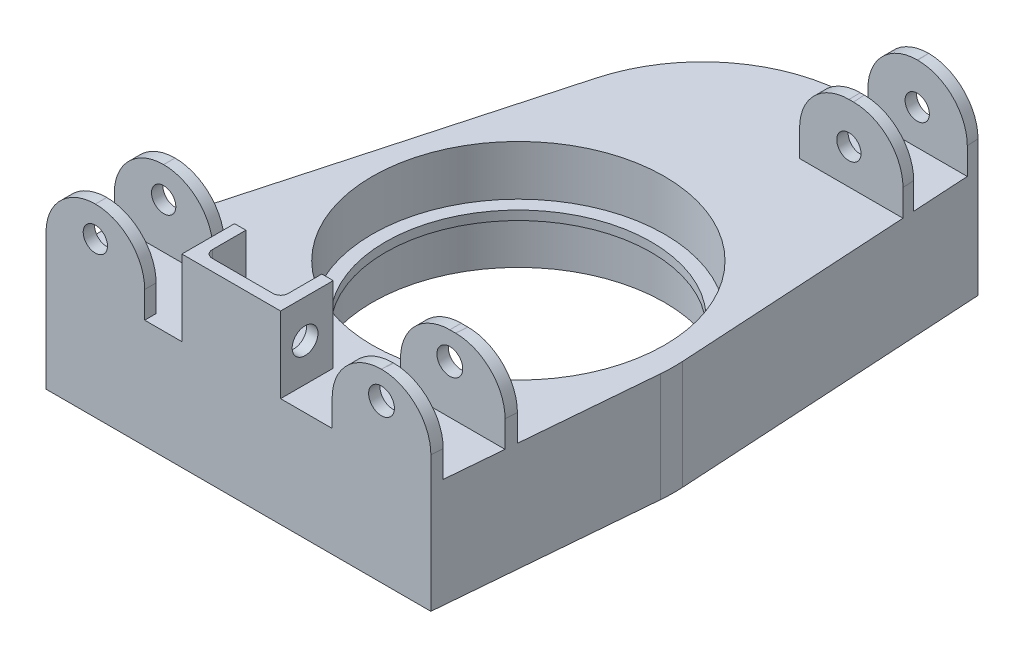
from build123d import *

# Parameters (mm, degrees)
SKETCH1_R                      = 48.895
BASE_DEPTH                     = 36.5
SKETCH2_W                      = 33.019999999999996
SKETCH2_H                      = 3.8100000000000023
A_ARMS_DEPTH                   = 25.4
FILLET_A_ARM_TAB_F_R           = 16.51
FILLET2_R                      = 50.8
SKETCH3_R                      = 4.191000000000014
SKETCH3_R_2                    = 4.190999999999996
BOSS_EXTRUDE3_DEPTH            = 10
FILLET3_R                      = 12.7
SKETCH6_R                      = 4.063999999999998
TAB_HOLES_1_DEPTH              = 38.1
SKETCH7_R                      = 4.064000000000002
TAB_HOLES_2_DEPTH              = 186.5408819792208
MID_FEATURE_BEARING_DEPTH      = 1.524
MID_FEATURE_BEARING_DEPTH_BACK = 1.524
SKETCH8_R                      = 48.895
SKETCH8_R_2                    = 44.449999999999996
SKETCH9_W                      = 3.8100000000000023
SKETCH9_H                      = 13.79577582478543
BOSS_EXTRUDE5_DEPTH            = 25.4
PUSHROD_STR_R                  = 2.54
SKETCH10_R                     = 4.318000000000003
PUSHROD_HOLES_DEPTH            = 151.10266140654986
SKETCH11_R                     = 4.317999999999998
TAB_HOLES_3_DEPTH              = 50.8


with BuildPart() as part:
    # Sketch1 → Base (new body)
    with BuildSketch(Plane(origin=(0, 0, 0), x_dir=(1, 0, 0), z_dir=(0, 1, 0))):
        with BuildLine():
            Line((-78.31659997030465, -79.72841359803415), (50.449322454190956, -79.72841359803415))
            Line((50.449322454190956, -79.72841359803415), (56.83927020061317, -5.288618846495341))
            Line((56.83927020061317, -5.288618846495341), (50.449322454190956, 103.33953733073578))
            Line((50.449322454190956, 103.33953733073578), (9.063812231160846, 103.33953733073578))
            ThreePointArc((9.063812231160846, 103.33953733073578), (-21.715617266777734, 92.95323203663254), (-39.90904079842039, 66.04137669220931))
            Line((-39.90904079842039, 66.04137669220931), (-72.74491081630002, -53.05841359803415))
            Line((-72.74491081630002, -53.05841359803415), (-78.31659997030464, -53.05841359803415))
            Line((-78.31659997030464, -53.05841359803415), (-78.31659997030465, -79.72841359803415))
        make_face()
        with Locations(Location((0, 0, 0), (0, 0, 270))):
            Circle(SKETCH1_R, mode=Mode.SUBTRACT)
    extrude(amount=BASE_DEPTH)

    # Sketch2 → A-Arms (add)
    with BuildSketch(Plane(origin=(0, 36.5, 0), x_dir=(1, 0, 0), z_dir=(0, 1, 0))):
        Polygon((50.449322454190956, 103.3395373307358), (50.673442072627154, 99.52953733073582), (17.429322454190952, 99.52953733073582), (17.429322454190952, 103.33953733073581), align=None)
        Polygon((17.429322454190977, -75.91841359803415), (50.77637468472341, -75.91841359803415), (50.449322454190956, -79.72841359803415), (17.429322454190974, -79.72841359803415), align=None)
        Polygon((17.429322454190952, 80.47953733073582), (17.42932245419096, 76.66953733073582), (52.01815978324433, 76.66953733073582), (51.79404016480813, 80.47953733073582), align=None)
        Polygon((17.429322454190974, -53.05841359803416), (52.738688067918105, -53.058413598034164), (52.41163583738566, -56.86841359803416), (17.429322454190974, -56.86841359803416), align=None)
        Polygon((-45.296599970304655, -53.05841359803415), (-78.31659997030464, -53.05841359803415), (-78.31659997030465, -56.86841359803416), (-45.296599970304655, -56.86841359803415), align=None)
        with Locations((-61.80659997030465, -77.82341359803415)):
            Rectangle(SKETCH2_W, SKETCH2_H)
    extrude(amount=A_ARMS_DEPTH)

    # Fillet a-arm tab f
    # the kernel refuses this fillet: 16.51 mm, written as the material it takes off along each edge
    with BuildSketch(Plane(origin=(54.3064585195025, 61.9, 34.794647560383474), x_dir=(0, -1, 0), z_dir=(-0.08552595602129841, 0, 0.9963359427656131))) as fillet_a_arm_tab_f_piece_1:
        with BuildLine():
            CenterArc((FILLET_A_ARM_TAB_F_R, -FILLET_A_ARM_TAB_F_R), FILLET_A_ARM_TAB_F_R, 90, 90)
            Line((-7.11e-15, -FILLET_A_ARM_TAB_F_R), (0, 0))
            Line((0, 0), (FILLET_A_ARM_TAB_F_R, 0))
        make_face()
    extrude(amount=86.37401139662217, mode=Mode.SUBTRACT)
    with BuildSketch(Plane(origin=(56.2687719026972, 61.9, 11.93464756038351), x_dir=(-4.3e-16, -1, -4e-17), z_dir=(-0.08552595602129671, 0, 0.9963359427656132))) as fillet_a_arm_tab_f_piece_2:
        with BuildLine():
            CenterArc((FILLET_A_ARM_TAB_F_R, -FILLET_A_ARM_TAB_F_R), FILLET_A_ARM_TAB_F_R, 90.00000000000003, 89.99999999999997)
            Line((-3e-17, -FILLET_A_ARM_TAB_F_R), (0, 0))
            Line((0, 0), (FILLET_A_ARM_TAB_F_R, 0))
        make_face()
    extrude(amount=86.37401139662215, mode=Mode.SUBTRACT)
    with BuildSketch(Plane(origin=(17.429322454190935, 61.9, 121.00341359803414), x_dir=(1, 4.3e-16, 9.3e-16), z_dir=(9.3e-16, 0, -1))) as fillet_a_arm_tab_f_piece_3:
        with BuildLine():
            CenterArc((FILLET_A_ARM_TAB_F_R, FILLET_A_ARM_TAB_F_R), FILLET_A_ARM_TAB_F_R, 180.00000000000003, 90)
            Line((-1.421e-14, FILLET_A_ARM_TAB_F_R), (0, 0))
            Line((0, 0), (FILLET_A_ARM_TAB_F_R, 0))
        make_face()
    extrude(amount=86.35999999999999, mode=Mode.SUBTRACT)
    with BuildSketch(Plane(origin=(17.429322454190974, 61.9, 98.14341359803416), x_dir=(-2.2e-16, -1, 0), z_dir=(0, 0, -1))) as fillet_a_arm_tab_f_piece_4:
        with BuildLine():
            CenterArc((FILLET_A_ARM_TAB_F_R, -FILLET_A_ARM_TAB_F_R), FILLET_A_ARM_TAB_F_R, 89.99999999999999, 90.00000000000001)
            Line((-1.066e-14, -FILLET_A_ARM_TAB_F_R), (0, 0))
            Line((0, 0), (FILLET_A_ARM_TAB_F_R, 0))
        make_face()
    extrude(amount=86.35999999999999, mode=Mode.SUBTRACT)
    with BuildSketch(Plane(origin=(54.44193248550869, 61.9, -35.46576382772086), x_dir=(3e-17, -1, 0), z_dir=(-0.05872253669931843, 0, -0.9982743428955776))) as fillet_a_arm_tab_f_piece_5:
        with BuildLine():
            CenterArc((FILLET_A_ARM_TAB_F_R, FILLET_A_ARM_TAB_F_R), FILLET_A_ARM_TAB_F_R, 180, 90)
            Line((-7.52e-15, FILLET_A_ARM_TAB_F_R), (0, 0))
            Line((0, 0), (FILLET_A_ARM_TAB_F_R, 0))
        make_face()
    extrude(amount=86.36658611895079, mode=Mode.SUBTRACT)
    with BuildSketch(Plane(origin=(48.025549751926604, 61.9, -144.54331083375075), x_dir=(-0.9982743428955775, 0, 0.05872253669931885), z_dir=(0.058722536699318865, 0, 0.9982743428955776))) as fillet_a_arm_tab_f_piece_6:
        with BuildLine():
            CenterArc((FILLET_A_ARM_TAB_F_R, FILLET_A_ARM_TAB_F_R), FILLET_A_ARM_TAB_F_R, 180.00000000000003, 90)
            Line((-8.77e-15, FILLET_A_ARM_TAB_F_R), (0, 0))
            Line((0, 0), (FILLET_A_ARM_TAB_F_R, 0))
        make_face()
    extrude(amount=86.36658611895078, mode=Mode.SUBTRACT)
    with BuildSketch(Plane(origin=(17.429322454190874, 61.9, -121.75453733073583), x_dir=(-2.2e-16, -1, 0), z_dir=(1.86e-15, 0, 1))) as fillet_a_arm_tab_f_piece_7:
        with BuildLine():
            CenterArc((FILLET_A_ARM_TAB_F_R, FILLET_A_ARM_TAB_F_R), FILLET_A_ARM_TAB_F_R, 180, 90)
            Line((-1.066e-14, FILLET_A_ARM_TAB_F_R), (0, 0))
            Line((0, 0), (FILLET_A_ARM_TAB_F_R, 0))
        make_face()
    extrude(amount=86.36000000000001, mode=Mode.SUBTRACT)
    with BuildSketch(Plane(origin=(17.429322454190952, 61.900000000000006, -58.25453733073583), x_dir=(2.2e-16, -1, 0), z_dir=(0, 0, -1))) as fillet_a_arm_tab_f_piece_8:
        with BuildLine():
            CenterArc((FILLET_A_ARM_TAB_F_R, -FILLET_A_ARM_TAB_F_R), FILLET_A_ARM_TAB_F_R, 90.00000000000001, 89.99999999999999)
            Line((3.55e-15, -FILLET_A_ARM_TAB_F_R), (0, 0))
            Line((0, 0), (FILLET_A_ARM_TAB_F_R, 0))
        make_face()
    extrude(amount=86.35999999999997, mode=Mode.SUBTRACT)
    with BuildSketch(Plane(origin=(-78.31659997030468, 61.9, 121.00341359803414), x_dir=(1, 4.3e-16, 0), z_dir=(0, 0, -1))) as fillet_a_arm_tab_f_piece_9:
        with BuildLine():
            CenterArc((FILLET_A_ARM_TAB_F_R, FILLET_A_ARM_TAB_F_R), FILLET_A_ARM_TAB_F_R, 180.00000000000003, 90)
            Line((-7.11e-15, FILLET_A_ARM_TAB_F_R), (0, 0))
            Line((0, 0), (FILLET_A_ARM_TAB_F_R, 0))
        make_face()
    extrude(amount=86.35999999999999, mode=Mode.SUBTRACT)
    with BuildSketch(Plane(origin=(-45.296599970304655, 61.900000000000006, 34.64341359803416), x_dir=(0, -1, 0), z_dir=(0, 0, 1))) as fillet_a_arm_tab_f_piece_10:
        with BuildLine():
            CenterArc((FILLET_A_ARM_TAB_F_R, -FILLET_A_ARM_TAB_F_R), FILLET_A_ARM_TAB_F_R, 90, 89.99999999999997)
            Line((0, -FILLET_A_ARM_TAB_F_R), (0, 0))
            Line((0, 0), (FILLET_A_ARM_TAB_F_R, 0))
        make_face()
    extrude(amount=86.35999999999999, mode=Mode.SUBTRACT)
    with BuildSketch(Plane(origin=(-45.296599970304655, 61.9, 98.14341359803416), x_dir=(-1, 4.3e-16, 0), z_dir=(0, 0, -1))) as fillet_a_arm_tab_f_piece_11:
        with BuildLine():
            CenterArc((FILLET_A_ARM_TAB_F_R, -FILLET_A_ARM_TAB_F_R), FILLET_A_ARM_TAB_F_R, 89.99999999999997, 90)
            Line((-7.11e-15, -FILLET_A_ARM_TAB_F_R), (0, 0))
            Line((0, 0), (FILLET_A_ARM_TAB_F_R, 0))
        make_face()
    extrude(amount=86.35999999999999, mode=Mode.SUBTRACT)
    with BuildSketch(Plane(origin=(-78.31659997030461, 61.9, 11.783413598034159), x_dir=(1, 4.3e-16, 3.73e-15), z_dir=(-3.73e-15, 0, 1))) as fillet_a_arm_tab_f_piece_12:
        with BuildLine():
            CenterArc((FILLET_A_ARM_TAB_F_R, -FILLET_A_ARM_TAB_F_R), FILLET_A_ARM_TAB_F_R, 89.99999999999997, 90)
            Line((-7.11e-15, -FILLET_A_ARM_TAB_F_R), (0, 0))
            Line((0, 0), (FILLET_A_ARM_TAB_F_R, 0))
        make_face()
    extrude(amount=86.36, mode=Mode.SUBTRACT)

    # Fillet2
    fillet2_edges = [part.edges().sort_by_distance(p)[0] for p in [
        (56.83927020061317, 18.25, 5.288618846495341),
    ]]
    fillet(fillet2_edges, radius=FILLET2_R)

    # Sketch3 → Boss-Extrude3 (add)
    with BuildSketch(Plane(origin=(0, 1, 0), x_dir=(-1, 0, 0), z_dir=(0, -1, 0))):
        with BuildLine():
            Line((43.854458680364935, 51.73085462926094), (63.97193553589411, -21.237739574507735))
            Line((63.97193553589411, -21.23773957450774), (72.18850644780878, -18.97242698412595))
            ThreePointArc((72.18850644780878, -18.972426984125953), (77.61812906849276, -10.048878041184466), (69.03903187444669, -4.089883253871238))
            ThreePointArc((69.03903187444669, -4.089883253871242), (65.51899089441646, -3.3234432694139), (63.39228079206122, -0.41565667280690477))
            Line((63.392280792061214, -0.41565667280690377), (54.01448307558028, 33.598783657509856))
            ThreePointArc((54.01448307558028, 33.598783657509856), (54.32028306249501, 37.12259649311495), (56.85200449493394, 39.59264854133208))
            ThreePointArc((56.85200449493394, 39.59264854133208), (60.937845875450805, 49.12269396499909), (51.73708276530621, 53.904097917281604))
            Line((51.73708276530621, 53.904097917281604), (43.854458680364935, 51.73085462926094))
        make_face()
        with Locations(Location((70.16323054358774, -11.626499029688759, 0), (0, 0, 90))):
            Circle(SKETCH3_R, mode=Mode.SUBTRACT)
        with Locations(Location((53.76235866952725, 46.55816996284442, 0), (0, 0, 90))):
            Circle(SKETCH3_R_2, mode=Mode.SUBTRACT)
    extrude(amount=-BOSS_EXTRUDE3_DEPTH)

    # Fillet3
    # the kernel refuses this fillet: 12.7 mm, written as the material it adds along each edge
    with BuildSketch(Plane(origin=(-43.854458680364935, 1, -51.73085462926094), x_dir=(0.26578423939908474, 0, -0.9640325399523867), z_dir=(0, 1, 0))) as fillet3_piece_1:
        with BuildLine():
            CenterArc((12.190157430730798, 12.699999999999996), FILLET3_R, 192.86192857505063, 77.13807142494932)
            Line((-0.19119096347594106, 9.872949957769716), (-1.4293258028966136, 9.59024495354669))
            ThreePointArc((-1.4293258028966136, 9.59024495354669), (-1.269999999999986, 8.176719932431535), (-1.2699999999999998, -1.12e-15))
            Line((-1.2699999999999998, -1.12e-15), (1.13e-15, -1.2699999999999996))
            Line((1.13e-15, -1.2699999999999996), (12.190157430730789, -1.2700000000000002))
            Line((12.190157430730789, -1.2700000000000002), (12.190157430730787, -3e-17))
        make_face()
    extrude(amount=10)
    with BuildSketch(Plane(origin=(-63.97193553589411, 1, 21.237739574507735), x_dir=(-0.26578423939908663, 0, 0.9640325399523861), z_dir=(0, 1, 0))) as fillet3_piece_2:
        with BuildLine():
            CenterArc((12.266078660835335, -12.700000000000003), FILLET3_R, 90.00000000000009, 78.13802054521597)
            Line((-0.1627205021867313, -10.089453818592379), (-1.405600418488939, -9.828399200451612))
            ThreePointArc((-1.405600418488939, -9.828399200451612), (-1.2699999999999627, -8.523126109747787), (-1.2699999999999998, -3.65e-15))
            Line((-1.2699999999999998, -3.65e-15), (-2.3e-16, 1.2700000000000007))
            Line((-2.3e-16, 1.2700000000000007), (12.266078660835314, 1.2699999999999927))
            Line((12.266078660835314, 1.2699999999999927), (12.266078660835316, -2.6e-16))
        make_face()
    extrude(amount=10)

    # Sketch6 → Tab Holes 1 (cut)
    with BuildSketch(Plane(origin=(0, 0, -103.33953733073578), x_dir=(-1, 0, 0), z_dir=(0, 0, -1))):
        with Locations((-33.92506485292849, 48.199999999999996)):
            Circle(SKETCH6_R)
    extrude(amount=-TAB_HOLES_1_DEPTH, mode=Mode.SUBTRACT)

    # Sketch7 → Tab Holes 2 (cut, through all)
    with BuildSketch(Plane(origin=(0, 0, 53.05841359803415), x_dir=(-1, 0, 0), z_dir=(0, 0, -1))):
        with Locations((61.80659997030466, 51.739999999999995)):
            Circle(SKETCH7_R)
    extrude(amount=-TAB_HOLES_2_DEPTH, mode=Mode.SUBTRACT)

    # Sketch8 → mid-feature bearing (add, two sides: drawn at the far end of the back side and taken through both)
    with BuildSketch(Plane(origin=(0, 18.25, 0), x_dir=(1, 0, 0), z_dir=(0, 1, 0)).offset(-MID_FEATURE_BEARING_DEPTH_BACK)):
        with Locations(Location((0, 0, 0), (0, 0, 270))):
            Circle(SKETCH8_R)
        with Locations(Location((0, 0, 0), (0, 0, 270))):
            Circle(SKETCH8_R_2, mode=Mode.SUBTRACT)
    extrude(amount=MID_FEATURE_BEARING_DEPTH + MID_FEATURE_BEARING_DEPTH_BACK)

    # Sketch9 → Boss-Extrude5 (add)
    with BuildSketch(Plane(origin=(0, 36.5, 0), x_dir=(1, 0, 0), z_dir=(0, 1, 0))):
        with Locations((-30.939030674505787, -69.02052568564145)):
            Rectangle(SKETCH9_W, SKETCH9_H)
        Polygon((-32.84403067450579, -75.91841359803416), (-32.84403067450579, -79.72841359803415), (0.17596932549421496, -79.72841359803415), (0.17596932549421165, -75.91841359803415), (-3.6340306745057873, -75.91841359803415), (-29.034030674505786, -75.91841359803416), align=None)
        Polygon((-3.6340306745057873, -75.91841359803415), (0.17596932549421496, -75.91841359803415), (0.17596932549421296, -62.122637773248734), (-3.6340306745057855, -62.122637773248734), align=None)
    extrude(amount=BOSS_EXTRUDE5_DEPTH)

    # Pushrod Str
    pushrod_str_edges = [part.edges().sort_by_distance(p)[0] for p in [
        (-3.6340306745057873, 49.2, 75.91841359803415),
        (-29.034030674505786, 49.2, 75.91841359803416),
    ]]
    fillet(pushrod_str_edges, radius=PUSHROD_STR_R)

    # Sketch10 → Pushrod Holes (cut, through all)
    with BuildSketch(Plane.ZY.offset(32.84403067450579)):
        with Locations((71.53649337653819, 49.199999999999996)):
            Circle(SKETCH10_R)
    extrude(amount=-PUSHROD_HOLES_DEPTH, mode=Mode.SUBTRACT)

    # Sketch11 → Tab Holes 3 (cut)
    with BuildSketch(Plane(origin=(0, 0, 79.72841359803415), x_dir=(-1, 0, 0), z_dir=(0, 0, -1))):
        with Locations(Location((-33.93932245419098, 52.73999996799999, 0), (0, 0, 180))):
            Circle(SKETCH11_R)
    extrude(amount=TAB_HOLES_3_DEPTH, mode=Mode.SUBTRACT)


solid = part.part
